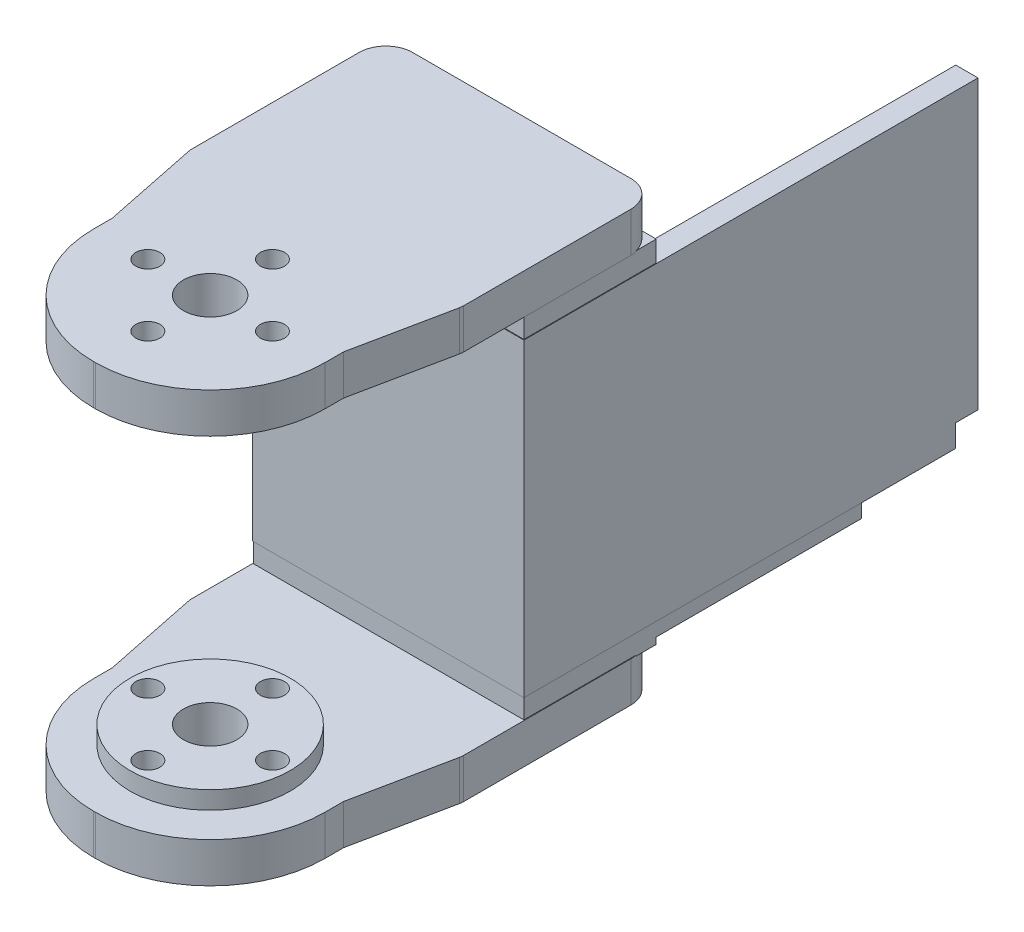
from build123d import *

# Parameters (mm, degrees)
BOSS_1_DEPTH    = 4.5
S_CYL2_R        = 9
BOSS_2_DEPTH    = 2
BOSS_3_DEPTH    = 4.5
S_BOX4_W        = 30.52
S_BOX4_H        = 34.8
BOSS_4_DEPTH    = 2.5
S_BOX5_W        = 2.5
S_BOX5_H        = 34.8
BOSS_5_DEPTH    = 51.02
S_BOX6_W        = 30.52
S_BOX6_H        = 2.4
BOSS_6_DEPTH    = 51.02
S_BOX7_W        = 2.5
S_BOX7_H        = 34.8
BOSS_7_DEPTH    = 18.01
S_BOX8_W        = 30.38
S_BOX8_H        = 2.675
BOSS_8_DEPTH    = 14.87
S_BOX9_W        = 30.38
S_BOX9_H        = 2.425
BOSS_9_DEPTH    = 14.87
S_BOX10_W       = 30.38
S_BOX10_H       = 1.65
BOSS_10_DEPTH   = 37.94
S_HOLE11_R      = 3
HOLE_11_DEPTH   = 4.7
S_HOLE12_R      = 1.35
HOLE_12_DEPTH   = 4.7
S_HOLE13_R      = 1.35
HOLE_13_DEPTH   = 4.7
S_HOLE14_R      = 1.35
HOLE_14_DEPTH   = 4.7
S_HOLE15_R      = 1.35
HOLE_15_DEPTH   = 4.7
S_HOLE16_R      = 3
HOLE_16_DEPTH   = 6.7
S_HOLE17_R      = 1.35
HOLE_17_DEPTH   = 6.7
S_HOLE18_R      = 1.35
HOLE_18_DEPTH   = 6.7
S_HOLE19_R      = 1.35
HOLE_19_DEPTH   = 6.7
S_HOLE20_R      = 1.35
HOLE_20_DEPTH   = 6.7
S_HOLE21_R      = 11
HOLE_21_DEPTH   = 2.6
S_HOLE22_R      = 1.1
HOLE_22_DEPTH   = 2.6
S_HOLE23_R      = 1.1
HOLE_23_DEPTH   = 2.6
S_HOLE24_R      = 1.1
HOLE_24_DEPTH   = 2.6
S_HOLE25_R      = 1.1
HOLE_25_DEPTH   = 2.6
S_CUT26_W       = 30.72
S_CUT26_H       = 2.6
POCKET_26_DEPTH = 2.6
S_HOLE27_R      = 2.5
HOLE_27_DEPTH   = 5.175
S_HOLE28_R      = 2.5
HOLE_28_DEPTH   = 5.175
S_HOLE29_R      = 11
HOLE_29_DEPTH   = 1.8
S_HOLE30_R      = 1.1
HOLE_30_DEPTH   = 1.8
S_HOLE31_R      = 2.1
HOLE_31_DEPTH   = 1.7
S_HOLE32_R      = 1.1
HOLE_32_DEPTH   = 1.8
S_HOLE33_R      = 2.1
HOLE_33_DEPTH   = 1.7
S_HOLE34_R      = 1.1
HOLE_34_DEPTH   = 1.8
S_HOLE35_R      = 2.1
HOLE_35_DEPTH   = 1.7
S_HOLE36_R      = 1.1
HOLE_36_DEPTH   = 1.8
S_HOLE37_R      = 2.1
HOLE_37_DEPTH   = 1.7


with BuildPart() as part:
    # S_prism1 → Boss_1 (new body)
    with BuildSketch(Plane(origin=(0, 18.625, 0), x_dir=(1, 0, 0), z_dir=(0, 1, 0))):
        with BuildLine():
            Line((-13, 2), (-15.2191, 12.8008))
            ThreePointArc((-15.2191, 12.8008), (-15.249701872, 13.001018419), (-15.26, 13.2033))
            Line((-15.26, 13.2033), (-15.26, 32))
            ThreePointArc((-15.26, 32), (-14.3813, 34.1213), (-12.26, 35))
            Line((-12.26, 35), (12.26, 35))
            ThreePointArc((12.26, 35), (14.3813, 34.1213), (15.26, 32))
            Line((15.26, 32), (15.26, 13.2033))
            ThreePointArc((15.26, 13.2033), (15.249701872, 13.001018419), (15.2191, 12.8008))
            Line((15.2191, 12.8008), (13, 2))
            Line((13, 2), (13, -0.1))
            ThreePointArc((13, -0.1), (9.2217, -9.2217), (0.1, -13))
            Line((0.1, -13), (-0.1, -13))
            ThreePointArc((-0.1, -13), (-9.2217, -9.2217), (-13, -0.1))
            Line((-13, -0.1), (-13, 2))
        make_face()
    extrude(amount=BOSS_1_DEPTH)



with BuildPart() as body_2:
    # S_cyl2 → Boss_2 (new body)
    with BuildSketch(Plane(origin=(0, -20.625, 0), x_dir=(1, 0, 0), z_dir=(0, 1, 0))):
        Circle(S_CYL2_R)
    extrude(amount=BOSS_2_DEPTH)

    # S_prism3 → Boss_3 (add)
    with BuildSketch(Plane(origin=(0, -25.125, 0), x_dir=(1, 0, 0), z_dir=(0, 1, 0))):
        with BuildLine():
            Line((-13, 2), (-15.2191, 12.8008))
            ThreePointArc((-15.2191, 12.8008), (-15.249701872, 13.001018419), (-15.26, 13.2033))
            Line((-15.26, 13.2033), (-15.26, 32))
            ThreePointArc((-15.26, 32), (-14.3813, 34.1213), (-12.26, 35))
            Line((-12.26, 35), (12.26, 35))
            ThreePointArc((12.26, 35), (14.3813, 34.1213), (15.26, 32))
            Line((15.26, 32), (15.26, 13.2033))
            ThreePointArc((15.26, 13.2033), (15.249701872, 13.001018419), (15.2191, 12.8008))
            Line((15.2191, 12.8008), (13, 2))
            Line((13, 2), (13, -0.1))
            ThreePointArc((13, -0.1), (9.2217, -9.2217), (0.1, -13))
            Line((0.1, -13), (-0.1, -13))
            ThreePointArc((-0.1, -13), (-9.2217, -9.2217), (-13, -0.1))
            Line((-13, -0.1), (-13, 2))
        make_face()
    extrude(amount=BOSS_3_DEPTH)


with BuildPart() as body_3:
    # S_box4 → Boss_4 (new body)
    with BuildSketch(Plane.XY.offset(-22.49)):
        with Locations((0, -1)):
            Rectangle(S_BOX4_W, S_BOX4_H)
    extrude(amount=BOSS_4_DEPTH)

    # S_box5 → Boss_5 (add)
    with BuildSketch(Plane.XY.offset(-71.01)):
        with Locations((14.01, -1)):
            Rectangle(S_BOX5_W, S_BOX5_H)
    extrude(amount=BOSS_5_DEPTH)

    # S_box6 → Boss_6 (add)
    with BuildSketch(Plane.XY.offset(-71.01)):
        with Locations((0, -17.2)):
            Rectangle(S_BOX6_W, S_BOX6_H)
    extrude(amount=BOSS_6_DEPTH)

    # S_box7 → Boss_7 (add)
    with BuildSketch(Plane.XY.offset(-38)):
        with Locations((-14.01, -1)):
            Rectangle(S_BOX7_W, S_BOX7_H)
    extrude(amount=BOSS_7_DEPTH)


with BuildPart() as part_1:
    add(part.part)

    add(body_3.part)  # Boss_8 merges body 3
    # S_box8 → Boss_8 (add)
    with BuildSketch(Plane.XY.offset(-34.93)):
        with Locations((0, 17.3875)):
            Rectangle(S_BOX8_W, S_BOX8_H)
    extrude(amount=BOSS_8_DEPTH)


    add(body_2.part)  # Boss_9 merges body 2
    # S_box9 → Boss_9 (add)
    with BuildSketch(Plane.XY.offset(-34.93)):
        with Locations((0, -19.5125)):
            Rectangle(S_BOX9_W, S_BOX9_H)
    extrude(amount=BOSS_9_DEPTH)

    # S_box10 → Boss_10 (add)
    with BuildSketch(Plane.XY.offset(-58)):
        with Locations((0, -19.175)):
            Rectangle(S_BOX10_W, S_BOX10_H)
    extrude(amount=BOSS_10_DEPTH)

    # S_hole11 → Hole_11 (cut)
    with BuildSketch(Plane(origin=(0, 18.525, 0), x_dir=(1, 0, 0), z_dir=(0, 1, 0))):
        Circle(S_HOLE11_R)
    extrude(amount=HOLE_11_DEPTH, mode=Mode.SUBTRACT)

    # S_hole12 → Hole_12 (cut)
    with BuildSketch(Plane(origin=(0, 18.525, 0), x_dir=(1, 0, 0), z_dir=(0, 1, 0))):
        with Locations((7, 0)):
            Circle(S_HOLE12_R)
    extrude(amount=HOLE_12_DEPTH, mode=Mode.SUBTRACT)

    # S_hole13 → Hole_13 (cut)
    with BuildSketch(Plane(origin=(0, 18.525, 0), x_dir=(1, 0, 0), z_dir=(0, 1, 0))):
        with Locations((0, -7)):
            Circle(S_HOLE13_R)
    extrude(amount=HOLE_13_DEPTH, mode=Mode.SUBTRACT)

    # S_hole14 → Hole_14 (cut)
    with BuildSketch(Plane(origin=(0, 18.525, 0), x_dir=(1, 0, 0), z_dir=(0, 1, 0))):
        with Locations((-7, 0)):
            Circle(S_HOLE14_R)
    extrude(amount=HOLE_14_DEPTH, mode=Mode.SUBTRACT)

    # S_hole15 → Hole_15 (cut)
    with BuildSketch(Plane(origin=(0, 18.525, 0), x_dir=(1, 0, 0), z_dir=(0, 1, 0))):
        with Locations((0, 7)):
            Circle(S_HOLE15_R)
    extrude(amount=HOLE_15_DEPTH, mode=Mode.SUBTRACT)

    # S_hole16 → Hole_16 (cut)
    with BuildSketch(Plane(origin=(0, -25.225, 0), x_dir=(1, 0, 0), z_dir=(0, 1, 0))):
        Circle(S_HOLE16_R)
    extrude(amount=HOLE_16_DEPTH, mode=Mode.SUBTRACT)

    # S_hole17 → Hole_17 (cut)
    with BuildSketch(Plane(origin=(0, -25.225, 0), x_dir=(1, 0, 0), z_dir=(0, 1, 0))):
        with Locations((7, 0)):
            Circle(S_HOLE17_R)
    extrude(amount=HOLE_17_DEPTH, mode=Mode.SUBTRACT)

    # S_hole18 → Hole_18 (cut)
    with BuildSketch(Plane(origin=(0, -25.225, 0), x_dir=(1, 0, 0), z_dir=(0, 1, 0))):
        with Locations((0, -7)):
            Circle(S_HOLE18_R)
    extrude(amount=HOLE_18_DEPTH, mode=Mode.SUBTRACT)

    # S_hole19 → Hole_19 (cut)
    with BuildSketch(Plane(origin=(0, -25.225, 0), x_dir=(1, 0, 0), z_dir=(0, 1, 0))):
        with Locations((-7, 0)):
            Circle(S_HOLE19_R)
    extrude(amount=HOLE_19_DEPTH, mode=Mode.SUBTRACT)

    # S_hole20 → Hole_20 (cut)
    with BuildSketch(Plane(origin=(0, -25.225, 0), x_dir=(1, 0, 0), z_dir=(0, 1, 0))):
        with Locations((0, 7)):
            Circle(S_HOLE20_R)
    extrude(amount=HOLE_20_DEPTH, mode=Mode.SUBTRACT)

    # S_hole21 → Hole_21 (cut)
    with BuildSketch(Plane(origin=(0, -18.5, 0), x_dir=(1, 0, 0), z_dir=(0, 1, 0))):
        with Locations((0, 58)):
            Circle(S_HOLE21_R)
    extrude(amount=HOLE_21_DEPTH, mode=Mode.SUBTRACT)

    # S_hole22 → Hole_22 (cut)
    with BuildSketch(Plane(origin=(0, -18.5, 0), x_dir=(1, 0, 0), z_dir=(0, 1, 0))):
        with Locations((-10.25, 49.7)):
            Circle(S_HOLE22_R)
    extrude(amount=HOLE_22_DEPTH, mode=Mode.SUBTRACT)

    # S_hole23 → Hole_23 (cut)
    with BuildSketch(Plane(origin=(0, -18.5, 0), x_dir=(1, 0, 0), z_dir=(0, 1, 0))):
        with Locations((10.25, 49.7)):
            Circle(S_HOLE23_R)
    extrude(amount=HOLE_23_DEPTH, mode=Mode.SUBTRACT)

    # S_hole24 → Hole_24 (cut)
    with BuildSketch(Plane(origin=(0, -18.5, 0), x_dir=(1, 0, 0), z_dir=(0, 1, 0))):
        with Locations((-10.25, 25.25)):
            Circle(S_HOLE24_R)
    extrude(amount=HOLE_24_DEPTH, mode=Mode.SUBTRACT)

    # S_hole25 → Hole_25 (cut)
    with BuildSketch(Plane(origin=(0, -18.5, 0), x_dir=(1, 0, 0), z_dir=(0, 1, 0))):
        with Locations((10.25, 25.25)):
            Circle(S_HOLE25_R)
    extrude(amount=HOLE_25_DEPTH, mode=Mode.SUBTRACT)

    # S_cut26 → Pocket_26 (cut)
    with BuildSketch(Plane.XY.offset(-71.11)):
        with Locations((0, -17.2)):
            Rectangle(S_CUT26_W, S_CUT26_H)
    extrude(amount=POCKET_26_DEPTH, mode=Mode.SUBTRACT)

    # S_hole27 → Hole_27 (cut)
    with BuildSketch(Plane(origin=(0, -25.225, 0), x_dir=(1, 0, 0), z_dir=(0, 1, 0))):
        with Locations((-10.25, 25.25)):
            Circle(S_HOLE27_R)
    extrude(amount=HOLE_27_DEPTH, mode=Mode.SUBTRACT)

    # S_hole28 → Hole_28 (cut)
    with BuildSketch(Plane(origin=(0, -25.225, 0), x_dir=(1, 0, 0), z_dir=(0, 1, 0))):
        with Locations((10.25, 25.25)):
            Circle(S_HOLE28_R)
    extrude(amount=HOLE_28_DEPTH, mode=Mode.SUBTRACT)

    # S_hole29 → Hole_29 (cut)
    with BuildSketch(Plane(origin=(0, -20.1, 0), x_dir=(1, 0, 0), z_dir=(0, 1, 0))):
        with Locations((0, 58)):
            Circle(S_HOLE29_R)
    extrude(amount=HOLE_29_DEPTH, mode=Mode.SUBTRACT)

    # S_hole30 → Hole_30 (cut)
    with BuildSketch(Plane(origin=(0, -20.1, 0), x_dir=(1, 0, 0), z_dir=(0, 1, 0))):
        with Locations((-10.25, 49.7)):
            Circle(S_HOLE30_R)
    extrude(amount=HOLE_30_DEPTH, mode=Mode.SUBTRACT)

    # S_hole31 → Hole_31 (cut)
    with BuildSketch(Plane(origin=(0, -20.1, 0), x_dir=(1, 0, 0), z_dir=(0, 1, 0))):
        with Locations((-10.25, 49.7)):
            Circle(S_HOLE31_R)
    extrude(amount=HOLE_31_DEPTH, mode=Mode.SUBTRACT)

    # S_hole32 → Hole_32 (cut)
    with BuildSketch(Plane(origin=(0, -20.1, 0), x_dir=(1, 0, 0), z_dir=(0, 1, 0))):
        with Locations((10.25, 49.7)):
            Circle(S_HOLE32_R)
    extrude(amount=HOLE_32_DEPTH, mode=Mode.SUBTRACT)

    # S_hole33 → Hole_33 (cut)
    with BuildSketch(Plane(origin=(0, -20.1, 0), x_dir=(1, 0, 0), z_dir=(0, 1, 0))):
        with Locations((10.25, 49.7)):
            Circle(S_HOLE33_R)
    extrude(amount=HOLE_33_DEPTH, mode=Mode.SUBTRACT)

    # S_hole34 → Hole_34 (cut)
    with BuildSketch(Plane(origin=(0, -20.1, 0), x_dir=(1, 0, 0), z_dir=(0, 1, 0))):
        with Locations((-10.25, 25.25)):
            Circle(S_HOLE34_R)
    extrude(amount=HOLE_34_DEPTH, mode=Mode.SUBTRACT)

    # S_hole35 → Hole_35 (cut)
    with BuildSketch(Plane(origin=(0, -20.1, 0), x_dir=(1, 0, 0), z_dir=(0, 1, 0))):
        with Locations((-10.25, 25.25)):
            Circle(S_HOLE35_R)
    extrude(amount=HOLE_35_DEPTH, mode=Mode.SUBTRACT)

    # S_hole36 → Hole_36 (cut)
    with BuildSketch(Plane(origin=(0, -20.1, 0), x_dir=(1, 0, 0), z_dir=(0, 1, 0))):
        with Locations((10.25, 25.25)):
            Circle(S_HOLE36_R)
    extrude(amount=HOLE_36_DEPTH, mode=Mode.SUBTRACT)

    # S_hole37 → Hole_37 (cut)
    with BuildSketch(Plane(origin=(0, -20.1, 0), x_dir=(1, 0, 0), z_dir=(0, 1, 0))):
        with Locations((10.25, 25.25)):
            Circle(S_HOLE37_R)
    extrude(amount=HOLE_37_DEPTH, mode=Mode.SUBTRACT)


solid = part_1.part
